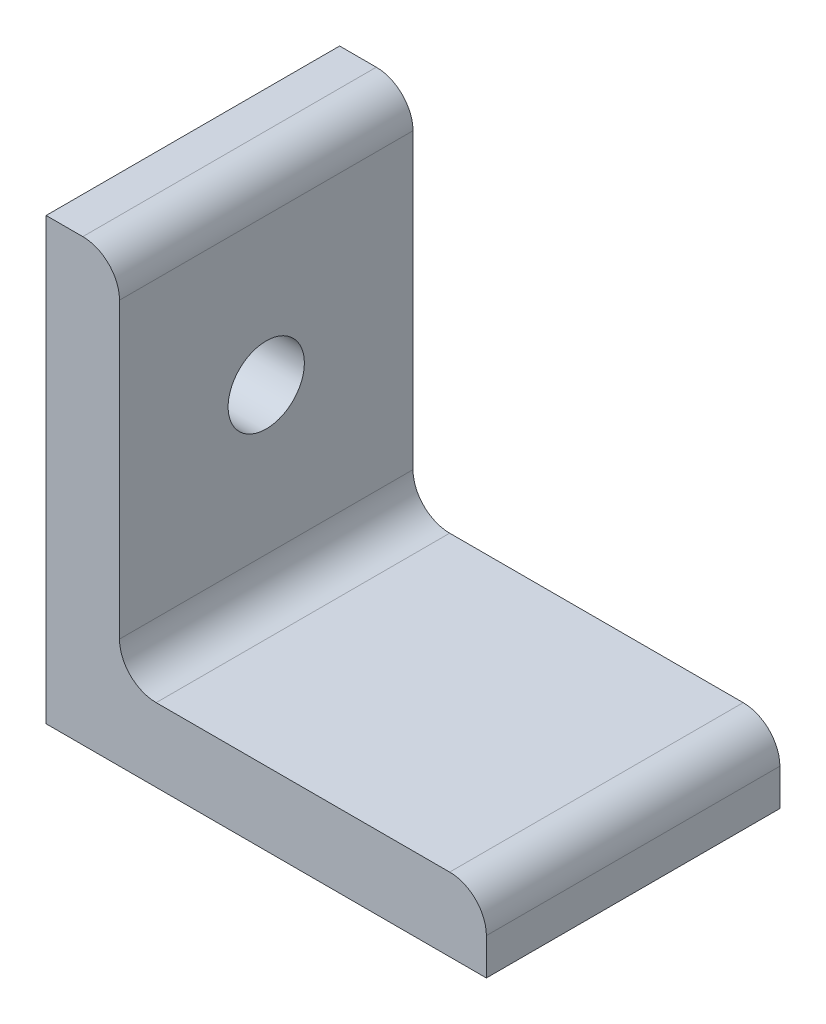
from build123d import *

# Parameters (mm, degrees)
BOSS_EXTRUDE1_DEPTH   = 6.35
FILLET1_R             = 1.5875
M4X0_7_TAPPED_HOLE1_D = 3.3


with BuildPart() as part:
    # Sketch3 → Boss-Extrude1 (new, symmetric)
    with BuildSketch(Plane.XY):
        Polygon((3.175, 19.05), (0, 19.05), (0, 0), (19.05, 0), (19.05, 3.175), (3.175, 3.175), align=None)
    extrude(amount=BOSS_EXTRUDE1_DEPTH, both=True)

    # Fillet1
    fillet1_edges = [part.edges().sort_by_distance(p)[0] for p in [
        (19.05, 3.175, 0),
        (3.175, 3.175, 0),
        (3.175, 19.05, 0),
    ]]
    fillet(fillet1_edges, radius=FILLET1_R)

    # M4x0.7 Tapped Hole1 (through all)
    with Locations(Plane(origin=(3.175, 0, 0), x_dir=(0, 0, -1), z_dir=(1, 0, 0))):
        with Locations((0, 11.1125)):
            Hole(M4X0_7_TAPPED_HOLE1_D / 2)


solid = part.part
